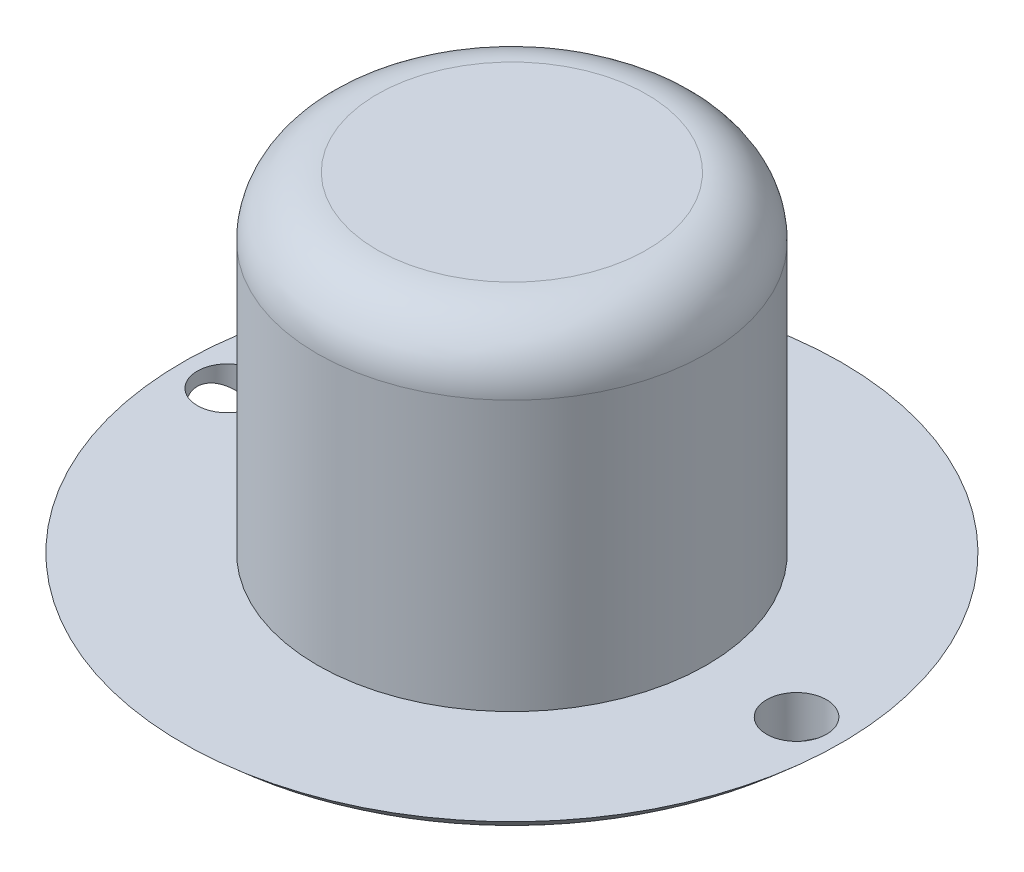
from build123d import *

# Parameters (mm, degrees)
SKETCH1_R           = 6.5
BOSS_EXTRUDE1_DEPTH = 11
SKETCH2_R           = 11
BOSS_EXTRUDE2_DEPTH = 2
FILLET1_R           = 7
DOME1_FACE_RADIUS   = 6.101020514
DOME1_HEIGHT        = 3
SKETCH3_R           = 1
CUT_EXTRUDE1_DEPTH  = 2
FILLET2_R           = 2


with BuildPart() as part:
    # Sketch1 → Boss-Extrude1 (new body)
    with BuildSketch(Plane(origin=(0, 0, 0), x_dir=(1, 0, 0), z_dir=(0, 1, 0))):
        with Locations(Location((0, 0, 0), (0, 0, 270))):
            Circle(SKETCH1_R)
    extrude(amount=BOSS_EXTRUDE1_DEPTH)

    # Sketch2 → Boss-Extrude2 (add)
    with BuildSketch(Plane.XZ):
        with Locations(Location((0, 0, 0), (0, 0, 270))):
            Circle(SKETCH2_R)
    extrude(amount=BOSS_EXTRUDE2_DEPTH)

    # Fillet1
    # the kernel refuses this fillet: 7 mm, written as the material it takes off along each edge
    with BuildSketch(Plane(origin=(0, -2, 0), x_dir=(0, 0, -1), z_dir=(-1, 0, 0))) as fillet1_piece_1:
        with BuildLine():
            CenterArc((6.101020514, -7), FILLET1_R, 45.584691403, 44.415308597)
            Line((6.101020514, 0), (6.101020514, 0.14))
            Line((6.101020514, 0.14), (11, 0.14))
            Line((11, 0.14), (11.14, 0))
            ThreePointArc((11.14, 0), (11.14, -1), (11.09797959, -1.9))
            Line((11.09797959, -1.9), (11, -2))
        make_face()
    revolve(axis=Axis((0, -2, 0), (0, -1, 0)), mode=Mode.SUBTRACT)

    # Dome1: a dome of height H over a round flat face of radius A is a cap of a sphere of radius (A * A + H * H) / (2 * H)
    dome1_r = (DOME1_FACE_RADIUS * DOME1_FACE_RADIUS + DOME1_HEIGHT * DOME1_HEIGHT) / (2 * DOME1_HEIGHT)
    dome1_base = Plane((0, -2, 0), z_dir=(0, -1, 0))
    with Locations(dome1_base.offset(DOME1_HEIGHT - dome1_r)):
        dome1_ball = Sphere(dome1_r, mode=Mode.PRIVATE)
    add(split(dome1_ball, bisect_by=dome1_base, keep=Keep.TOP, mode=Mode.PRIVATE))

    # Sketch3 → Cut-Extrude1 (cut)
    with BuildSketch(Plane(origin=(0, 0, 0), x_dir=(1, 0, 0), z_dir=(0, 1, 0))):
        with Locations(Location((-9.5, 0, 0), (0, 0, 270))):
            Circle(SKETCH3_R)
        with Locations(Location((9.5, 0, 0), (0, 0, 270))):
            Circle(SKETCH3_R)
    extrude(amount=-CUT_EXTRUDE1_DEPTH, mode=Mode.SUBTRACT)

    # Fillet2
    fillet2_edges = [part.edges().sort_by_distance(p)[0] for p in [
        (0, 11, -6.5),
    ]]
    fillet(fillet2_edges, radius=FILLET2_R)


solid = part.part
